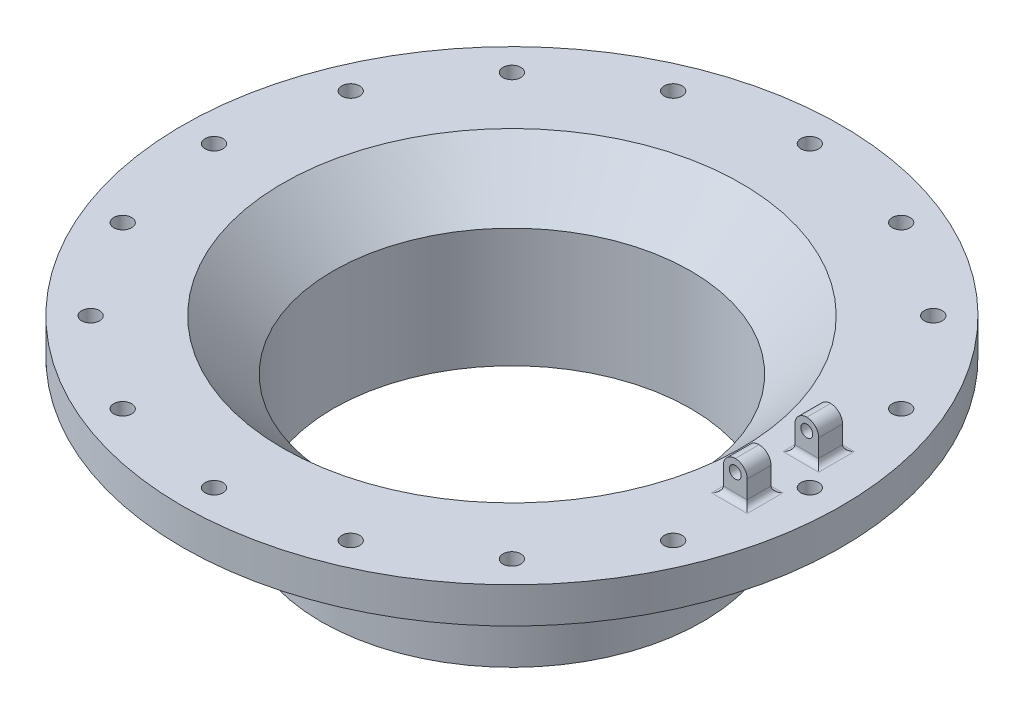
from build123d import *

# Parameters (mm, degrees)
SKETCH2_R           = 15
CUT_EXTRUDE2_DEPTH  = 130
FILLET1_R           = 10
SKETCH3_W           = 40
SKETCH3_H           = 40
BOSS_EXTRUDE1_DEPTH = 60
SKETCH4_R           = 10
CUT_EXTRUDE3_DEPTH  = 340
FILLET2_R           = 20
FILLET3_R           = 10
SKETCH5_R           = 1.097674429
SKETCH5_R_2         = 1.1


# Read off the part's stored shape, not the designer's step: Revolve1
with BuildPart() as part:
    # Revolve1 outline → Revolve1 (revolve)
    with BuildSketch(Plane.XY):
        Polygon((318.333333333, -90.126406871), (320, -90.126406871), (320, -50.710678119), (353.13708499, -17.573593129), (553.13708499, -17.573593129), (553.13708499, 42.426406871), (384.852813742, 42.426406871), (300, -42.426406871), (300, -242.426406871), (320, -242.426406871), (320, -142.426406871), (318.333333333, -142.426406871), (318.333333333, -140.126406871), (320, -140.126406871), (320, -92.426406871), (318.333333333, -92.426406871), align=None)
    revolve(axis=Axis((0, 0, 0), (0, 1, 0)))

    # Sketch2 → Cut-Extrude2 (cut)
    with BuildSketch(Plane(origin=(0, 42.426406871, 0), x_dir=(1, 0, 0), z_dir=(0, 1, 0))):
        with Locations(Location((500, 0, 0), (0, 0, 270))):
            Circle(SKETCH2_R)
        with Locations(Location((461.939766256, -191.341716183, 0), (0, 0, 270))):
            Circle(SKETCH2_R)
        with Locations(Location((353.553390593, -353.553390593, 0), (0, 0, 270))):
            Circle(SKETCH2_R)
        with Locations(Location((191.341716183, -461.939766256, 0), (0, 0, 270))):
            Circle(SKETCH2_R)
        with Locations(Location((0, -500, 0), (0, 0, 270))):
            Circle(SKETCH2_R)
        with Locations(Location((-191.341716183, -461.939766256, 0), (0, 0, 270))):
            Circle(SKETCH2_R)
        with Locations(Location((-353.553390593, -353.553390593, 0), (0, 0, 270))):
            Circle(SKETCH2_R)
        with Locations(Location((-461.939766256, -191.341716183, 0), (0, 0, 270))):
            Circle(SKETCH2_R)
        with Locations(Location((-500, 0, 0), (0, 0, 270))):
            Circle(SKETCH2_R)
        with Locations(Location((-461.939766256, 191.341716183, 0), (0, 0, 270))):
            Circle(SKETCH2_R)
        with Locations(Location((-353.553390593, 353.553390593, 0), (0, 0, 270))):
            Circle(SKETCH2_R)
        with Locations(Location((-191.341716183, 461.939766256, 0), (0, 0, 270))):
            Circle(SKETCH2_R)
        with Locations(Location((0, 500, 0), (0, 0, 270))):
            Circle(SKETCH2_R)
        with Locations(Location((191.341716183, 461.939766256, 0), (0, 0, 270))):
            Circle(SKETCH2_R)
        with Locations(Location((353.553390593, 353.553390593, 0), (0, 0, 270))):
            Circle(SKETCH2_R)
        with Locations(Location((461.939766256, 191.341716183, 0), (0, 0, 270))):
            Circle(SKETCH2_R)
    extrude(amount=-CUT_EXTRUDE2_DEPTH, mode=Mode.SUBTRACT)

    # Fillet1
    fillet1_edges = [part.edges().sort_by_distance(p)[0] for p in [
        (-353.13708499, -17.573593129, 0),
        (-320, -50.710678119, 0),
    ]]
    fillet(fillet1_edges, radius=FILLET1_R)

    # Sketch3 → Boss-Extrude1 (add)
    with BuildSketch(Plane(origin=(0, 42.426406871, 0), x_dir=(1, 0, 0), z_dir=(0, 1, 0))):
        with Locations((454.852813742, 60)):
            Rectangle(SKETCH3_W, SKETCH3_H)
        with Locations((454.852813742, -60)):
            Rectangle(SKETCH3_W, SKETCH3_H)
    extrude(amount=BOSS_EXTRUDE1_DEPTH)

    # Sketch4 → Cut-Extrude3 (cut)
    with BuildSketch(Plane.XY.offset(80)):
        with Locations((454.852813742, 82.426406871)):
            Circle(SKETCH4_R)
    extrude(amount=-CUT_EXTRUDE3_DEPTH, mode=Mode.SUBTRACT)

    # Fillet2
    fillet2_edges = [part.edges().sort_by_distance(p)[0] for p in [
        (474.852813742, 102.426406871, -60),
        (434.852813742, 102.426406871, -60),
        (434.852813742, 102.426406871, 60),
        (474.852813742, 102.426406871, 60),
    ]]
    fillet(fillet2_edges, radius=FILLET2_R - 0.0001)  # a hair under: the kernel refuses the full size

    # Fillet3
    fillet3_edges = [part.edges().sort_by_distance(p)[0] for p in [
        (474.852813742, 42.426406871, -60),
        (454.852813742, 42.426406871, -80),
        (434.852813742, 42.426406871, -60),
        (454.852813742, 42.426406871, -40),
        (454.852813742, 42.426406871, 40),
        (434.852813742, 42.426406871, 60),
        (454.852813742, 42.426406871, 80),
        (474.852813742, 42.426406871, 60),
    ]]
    fillet(fillet3_edges, radius=FILLET3_R)


with BuildPart() as body_2:
    # Sketch5 → Revolve2 (revolve)
    with BuildSketch(Plane.XY, mode=Mode.PRIVATE) as revolve2_sk:
        with Locations((319.44213417, -91.28689488)):
            Circle(SKETCH5_R)
        with Locations((319.509031711, -141.261208914)):
            Circle(SKETCH5_R_2)
    revolve(revolve2_sk.sketch.rotate(Axis((0, 86.974737714, 0), (0, -1, 0)), 90), axis=Axis((0, 86.974737714, 0), (0, -1, 0)))


solid = Compound([part.part, body_2.part])
